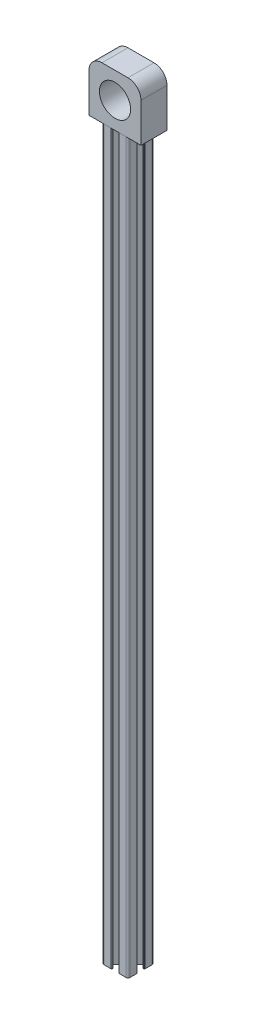
from build123d import *

# Parameters (mm, degrees)
BOSS_EXTRUDE1_DEPTH = 560
SKETCH2_W           = 40
SKETCH2_H           = 20
HINGE_BOX_DEPTH     = 40
FILLET1_R           = 10
SKETCH3_R           = 12
HINGE_HOLE_DEPTH    = 40


with BuildPart() as part:
    # Sketch1 → Boss-Extrude1 (new body)
    with BuildSketch(Plane(origin=(0, 0, 0), x_dir=(1, 0, 0), z_dir=(0, 1, 0))):
        with BuildLine():
            Line((9.494919477, 2.658080263), (9.010919477, 2.658080263))
            ThreePointArc((9.010919477, 2.658080263), (8.651709233, 2.806870018), (8.502919477, 3.166080263))
            Line((8.502919477, 3.166080263), (8.502919477, 5.515080263))
            ThreePointArc((8.502919477, 5.515080263), (8.354129722, 5.874290508), (7.994919477, 6.023080263))
            Line((7.994919477, 6.023080263), (7.269000139, 6.023080263))
            ThreePointArc((7.269000139, 6.023080263), (7.074596955, 5.984411065), (6.909789894, 5.874290508))
            Line((6.909789894, 5.874290508), (3.806709233, 2.771209846))
            ThreePointArc((3.806709233, 2.771209846), (3.696588675, 2.606402785), (3.657919477, 2.411999602))
            Line((3.657919477, 2.411999602), (3.657919477, -2.355839076))
            ThreePointArc((3.657919477, -2.355839076), (3.696588675, -2.550242259), (3.806709233, -2.71504932))
            Line((3.806709233, -2.71504932), (6.909789894, -5.818129982))
            ThreePointArc((6.909789894, -5.818129982), (7.074596955, -5.92825054), (7.269000139, -5.966919737))
            Line((7.269000139, -5.966919737), (7.994919477, -5.966919737))
            ThreePointArc((7.994919477, -5.966919737), (8.354129722, -5.818129982), (8.502919477, -5.458919737))
            Line((8.502919477, -5.458919737), (8.502919477, -3.109919737))
            ThreePointArc((8.502919477, -3.109919737), (8.651709233, -2.750709492), (9.010919477, -2.601919737))
            Line((9.010919477, -2.601919737), (9.494919477, -2.601919737))
            ThreePointArc((9.494919477, -2.601919737), (9.854129722, -2.750709492), (10.002919477, -3.109919737))
            Line((10.002919477, -3.109919737), (10.002919477, -8.471919737))
            ThreePointArc((10.002919477, -8.471919737), (9.563579649, -9.532579909), (8.502919477, -9.971919737))
            Line((8.502919477, -9.971919737), (3.140919477, -9.971919737))
            ThreePointArc((3.140919477, -9.971919737), (2.781709233, -9.823129982), (2.632919477, -9.463919737))
            Line((2.632919477, -9.463919737), (2.632919477, -8.979919737))
            ThreePointArc((2.632919477, -8.979919737), (2.781709233, -8.620709492), (3.140919477, -8.471919737))
            Line((3.140919477, -8.471919737), (5.489919477, -8.471919737))
            ThreePointArc((5.489919477, -8.471919737), (5.849129722, -8.323129982), (5.997919477, -7.963919737))
            Line((5.997919477, -7.963919737), (5.997919477, -7.238000398))
            ThreePointArc((5.997919477, -7.238000398), (5.95925028, -7.043597215), (5.849129722, -6.878790154))
            Line((5.849129722, -6.878790154), (2.746049061, -3.775709492))
            ThreePointArc((2.746049061, -3.775709492), (2.581242, -3.665588935), (2.386838816, -3.626919737))
            Line((2.386838816, -3.626919737), (-2.380999861, -3.626919737))
            ThreePointArc((-2.380999861, -3.626919737), (-2.575403045, -3.665588935), (-2.740210106, -3.775709492))
            Line((-2.740210106, -3.775709492), (-5.843290767, -6.878790154))
            ThreePointArc((-5.843290767, -6.878790154), (-5.953411325, -7.043597215), (-5.992080523, -7.238000398))
            Line((-5.992080523, -7.238000398), (-5.992080523, -7.963919737))
            ThreePointArc((-5.992080523, -7.963919737), (-5.843290767, -8.323129982), (-5.484080523, -8.471919737))
            Line((-5.484080523, -8.471919737), (-3.135080523, -8.471919737))
            ThreePointArc((-3.135080523, -8.471919737), (-2.775870278, -8.620709492), (-2.627080523, -8.979919737))
            Line((-2.627080523, -8.979919737), (-2.627080523, -9.463919737))
            ThreePointArc((-2.627080523, -9.463919737), (-2.775870278, -9.823129982), (-3.135080523, -9.971919737))
            Line((-3.135080523, -9.971919737), (-8.497080523, -9.971919737))
            ThreePointArc((-8.497080523, -9.971919737), (-9.557740694, -9.532579909), (-9.997080523, -8.471919737))
            Line((-9.997080523, -8.471919737), (-9.997080523, -3.109919737))
            ThreePointArc((-9.997080523, -3.109919737), (-9.848290767, -2.750709492), (-9.489080523, -2.601919737))
            Line((-9.489080523, -2.601919737), (-9.005080523, -2.601919737))
            ThreePointArc((-9.005080523, -2.601919737), (-8.645870278, -2.750709492), (-8.497080523, -3.109919737))
            Line((-8.497080523, -3.109919737), (-8.497080523, -5.458919737))
            ThreePointArc((-8.497080523, -5.458919737), (-8.348290767, -5.818129982), (-7.989080523, -5.966919737))
            Line((-7.989080523, -5.966919737), (-7.263161184, -5.966919737))
            ThreePointArc((-7.263161184, -5.966919737), (-7.068758, -5.92825054), (-6.903950939, -5.818129982))
            Line((-6.903950939, -5.818129982), (-3.800870278, -2.71504932))
            ThreePointArc((-3.800870278, -2.71504932), (-3.69074972, -2.550242259), (-3.652080523, -2.355839076))
            Line((-3.652080523, -2.355839076), (-3.652080523, 2.411999602))
            ThreePointArc((-3.652080523, 2.411999602), (-3.69074972, 2.606402785), (-3.800870278, 2.771209846))
            Line((-3.800870278, 2.771209846), (-6.903950939, 5.874290508))
            ThreePointArc((-6.903950939, 5.874290508), (-7.068758, 5.984411065), (-7.263161184, 6.023080263))
            Line((-7.263161184, 6.023080263), (-7.989080523, 6.023080263))
            ThreePointArc((-7.989080523, 6.023080263), (-8.348290767, 5.874290508), (-8.497080523, 5.515080263))
            Line((-8.497080523, 5.515080263), (-8.497080523, 3.166080263))
            ThreePointArc((-8.497080523, 3.166080263), (-8.645870278, 2.806870018), (-9.005080523, 2.658080263))
            Line((-9.005080523, 2.658080263), (-9.489080523, 2.658080263))
            ThreePointArc((-9.489080523, 2.658080263), (-9.848290767, 2.806870018), (-9.997080523, 3.166080263))
            Line((-9.997080523, 3.166080263), (-9.997080523, 8.528080263))
            ThreePointArc((-9.997080523, 8.528080263), (-9.557740694, 9.588740435), (-8.497080523, 10.028080263))
            Line((-8.497080523, 10.028080263), (-3.135080523, 10.028080263))
            ThreePointArc((-3.135080523, 10.028080263), (-2.775870278, 9.879290508), (-2.627080523, 9.520080263))
            Line((-2.627080523, 9.520080263), (-2.627080523, 9.036080263))
            ThreePointArc((-2.627080523, 9.036080263), (-2.775870278, 8.676870018), (-3.135080523, 8.528080263))
            Line((-3.135080523, 8.528080263), (-5.484080523, 8.528080263))
            ThreePointArc((-5.484080523, 8.528080263), (-5.843290767, 8.379290508), (-5.992080523, 8.020080263))
            Line((-5.992080523, 8.020080263), (-5.992080523, 7.294160924))
            ThreePointArc((-5.992080523, 7.294160924), (-5.953411325, 7.099757741), (-5.843290767, 6.93495068))
            Line((-5.843290767, 6.93495068), (-2.740210106, 3.831870018))
            ThreePointArc((-2.740210106, 3.831870018), (-2.575403045, 3.72174946), (-2.380999861, 3.683080263))
            Line((-2.380999861, 3.683080263), (2.386838816, 3.683080263))
            ThreePointArc((2.386838816, 3.683080263), (2.581242, 3.72174946), (2.746049061, 3.831870018))
            Line((2.746049061, 3.831870018), (5.849129722, 6.93495068))
            ThreePointArc((5.849129722, 6.93495068), (5.95925028, 7.099757741), (5.997919477, 7.294160924))
            Line((5.997919477, 7.294160924), (5.997919477, 8.020080263))
            ThreePointArc((5.997919477, 8.020080263), (5.849129722, 8.379290508), (5.489919477, 8.528080263))
            Line((5.489919477, 8.528080263), (3.140919477, 8.528080263))
            ThreePointArc((3.140919477, 8.528080263), (2.781709233, 8.676870018), (2.632919477, 9.036080263))
            Line((2.632919477, 9.036080263), (2.632919477, 9.520080263))
            ThreePointArc((2.632919477, 9.520080263), (2.781709233, 9.879290508), (3.140919477, 10.028080263))
            Line((3.140919477, 10.028080263), (8.502919477, 10.028080263))
            ThreePointArc((8.502919477, 10.028080263), (9.563579649, 9.588740435), (10.002919477, 8.528080263))
            Line((10.002919477, 8.528080263), (10.002919477, 3.166080263))
            ThreePointArc((10.002919477, 3.166080263), (9.854129722, 2.806870018), (9.494919477, 2.658080263))
        make_face()
        with BuildLine():
            Line((2.127820321, -2.276425703), (2.307425444, -2.096820581))
            ThreePointArc((2.307425444, -2.096820581), (2.508857494, -1.328387548), (1.938052984, -0.775896455))
            ThreePointArc((1.938052984, -0.775896455), (2.098419477, 0.028080263), (1.938052984, 0.832056981))
            ThreePointArc((1.938052984, 0.832056981), (2.508857494, 1.384548074), (2.307425444, 2.152981107))
            Line((2.307425444, 2.152981107), (2.127820321, 2.332586229))
            ThreePointArc((2.127820321, 2.332586229), (1.359387288, 2.53401828), (0.806896195, 1.963213769))
            ThreePointArc((0.806896195, 1.963213769), (0.002919477, 2.123580263), (-0.801057241, 1.963213769))
            ThreePointArc((-0.801057241, 1.963213769), (-1.353548333, 2.53401828), (-2.121981366, 2.332586229))
            Line((-2.121981366, 2.332586229), (-2.301586489, 2.152981107))
            ThreePointArc((-2.301586489, 2.152981107), (-2.503018539, 1.384548074), (-1.932214029, 0.832056981))
            ThreePointArc((-1.932214029, 0.832056981), (-2.092580523, 0.028080263), (-1.932214029, -0.775896455))
            ThreePointArc((-1.932214029, -0.775896455), (-2.503018539, -1.328387548), (-2.301586489, -2.096820581))
            Line((-2.301586489, -2.096820581), (-2.121981366, -2.276425703))
            ThreePointArc((-2.121981366, -2.276425703), (-1.353548333, -2.477857754), (-0.801057241, -1.907053243))
            ThreePointArc((-0.801057241, -1.907053243), (0.002919477, -2.067419737), (0.806896195, -1.907053243))
            ThreePointArc((0.806896195, -1.907053243), (1.359387288, -2.477857754), (2.127820321, -2.276425703))
        make_face(mode=Mode.SUBTRACT)
    extrude(amount=BOSS_EXTRUDE1_DEPTH)

    # Sketch2 → Hinge Box (add)
    with BuildSketch(Plane(origin=(0, 560, 0), x_dir=(1, 0, 0), z_dir=(0, 1, 0))):
        Rectangle(SKETCH2_W, SKETCH2_H)
    extrude(amount=HINGE_BOX_DEPTH)

    # Fillet1
    fillet1_edges = [part.edges().sort_by_distance(p)[0] for p in [
        (-20, 600, 0),
        (20, 600, 0),
    ]]
    fillet(fillet1_edges, radius=FILLET1_R)

    # Sketch3 → Hinge Hole (cut)
    with BuildSketch(Plane.XY.offset(10)):
        with Locations((0, 580)):
            Circle(SKETCH3_R)
    extrude(amount=-HINGE_HOLE_DEPTH, mode=Mode.SUBTRACT)


solid = part.part
